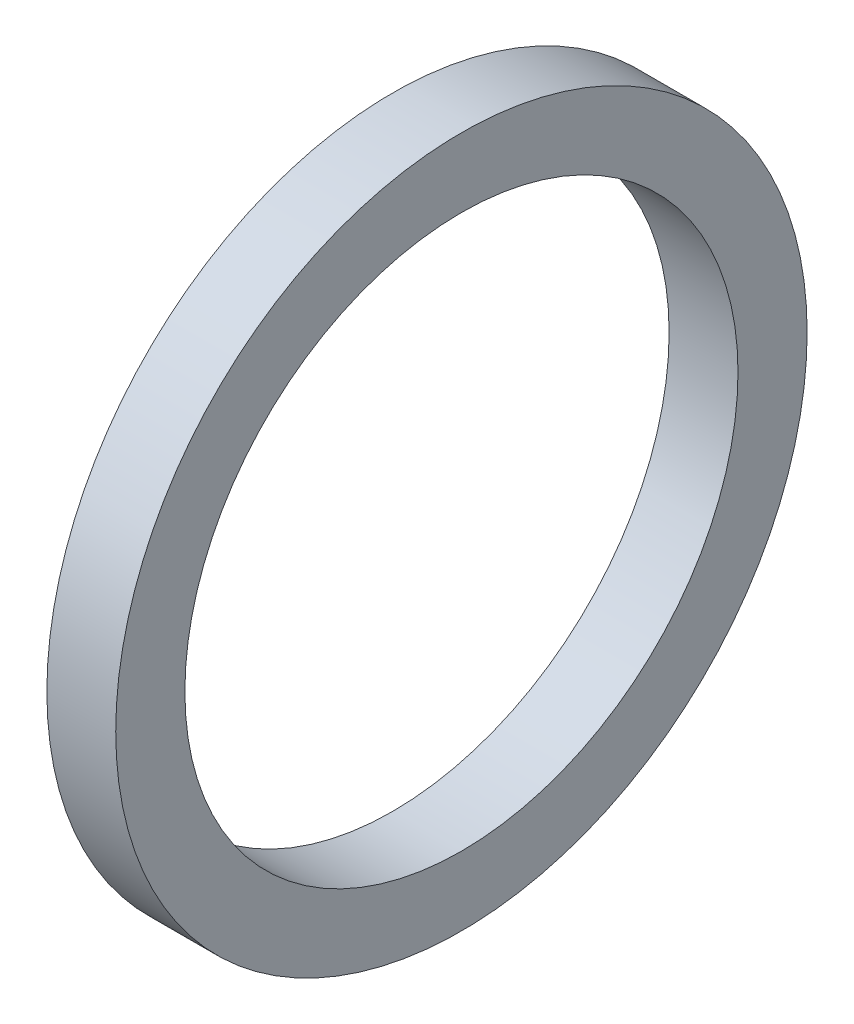
from build123d import *

# Parameters (mm, degrees)
SKETCH3_W = 9.959999892
SKETCH3_H = 9.999999939


with BuildPart() as part:
    # Sketch3 → Revolve1 (revolve)
    with BuildSketch(Plane.XY):
        with Locations((15.050400176, 44.99999998)):
            Rectangle(SKETCH3_W, SKETCH3_H)
    revolve(axis=Axis((0, 0, 0), (1, 0, 0)))


solid = part.part
